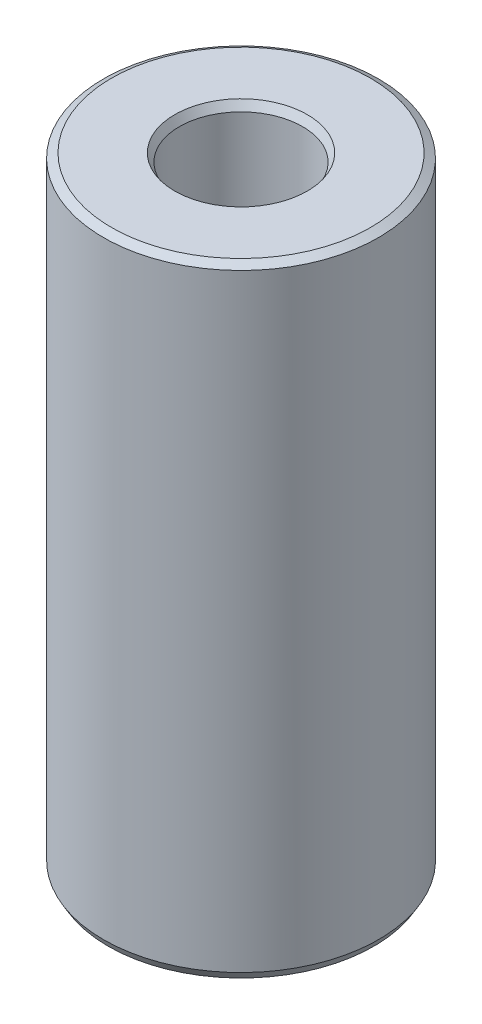
from build123d import *
from OCP.BRepFilletAPI import BRepFilletAPI_MakeChamfer

# Parameters (mm, degrees)
SKETCH1_R           = 52.5
BOSS_EXTRUDE1_DEPTH = 236.974460437
SKETCH2_R           = 23.524693765
CUT_EXTRUDE1_DEPTH  = 249.333233578
CHAMFER1_SIZE       = 1.778941447
CHAMFER1_SIZE2      = 3.08121697


with BuildPart() as part:
    # Sketch1 → Boss-Extrude1 (new body)
    with BuildSketch(Plane(origin=(0, 0, 0), x_dir=(1, 0, 0), z_dir=(0, 1, 0))):
        Circle(SKETCH1_R)
    extrude(amount=BOSS_EXTRUDE1_DEPTH)

    # Sketch2 → Cut-Extrude1 (cut, through all)
    with BuildSketch(Plane(origin=(0, 0, 0), x_dir=(1, 0, 0), z_dir=(0, 1, 0))):
        Circle(SKETCH2_R)
    extrude(amount=CUT_EXTRUDE1_DEPTH, mode=Mode.SUBTRACT)

    # Chamfer1: one chamfer whose edges measure the first distance from different faces: ONE call of the kernel's chamfer builder (chamfer() names one face for all edges)
    chamfer1_edges_1 = [part.edges().sort_by_distance(p)[0] for p in [
        (-23.524693765, 236.974460437, 0),
    ]]
    chamfer1_side_1 = [part.faces().sort_by_distance(p)[0] for p in [
        (-51.01507576, 236.974460437, 0),
    ]]
    chamfer1_edges_2 = [part.edges().sort_by_distance(p)[0] for p in [
        (-23.524693765, 0, 0),
    ]]
    chamfer1_side_2 = [part.faces().sort_by_distance(p)[0] for p in [
        (-23.524693765, 118.487230219, 0),
    ]]
    chamfer1_edges_3 = [part.edges().sort_by_distance(p)[0] for p in [
        (-52.5, 0, 0),
    ]]
    chamfer1_side_3 = [part.faces().sort_by_distance(p)[0] for p in [
        (-51.01507576, 0, 0),
    ]]
    chamfer1_edges_4 = [part.edges().sort_by_distance(p)[0] for p in [
        (-52.5, 236.974460437, 0),
    ]]
    chamfer1_side_4 = [part.faces().sort_by_distance(p)[0] for p in [
        (-52.5, 118.487230219, 0),
    ]]
    chamfer1 = BRepFilletAPI_MakeChamfer(part.part.solid().wrapped)
    for e in chamfer1_edges_1:
        chamfer1.Add(CHAMFER1_SIZE, CHAMFER1_SIZE2, e.wrapped, chamfer1_side_1[0].wrapped)  # the first distance lies on this face
    for e in chamfer1_edges_2:
        chamfer1.Add(CHAMFER1_SIZE, CHAMFER1_SIZE2, e.wrapped, chamfer1_side_2[0].wrapped)  # the first distance lies on this face
    for e in chamfer1_edges_3:
        chamfer1.Add(CHAMFER1_SIZE, CHAMFER1_SIZE2, e.wrapped, chamfer1_side_3[0].wrapped)  # the first distance lies on this face
    for e in chamfer1_edges_4:
        chamfer1.Add(CHAMFER1_SIZE, CHAMFER1_SIZE2, e.wrapped, chamfer1_side_4[0].wrapped)  # the first distance lies on this face
    add(Compound.cast(chamfer1.Shape()), mode=Mode.REPLACE)


solid = part.part
